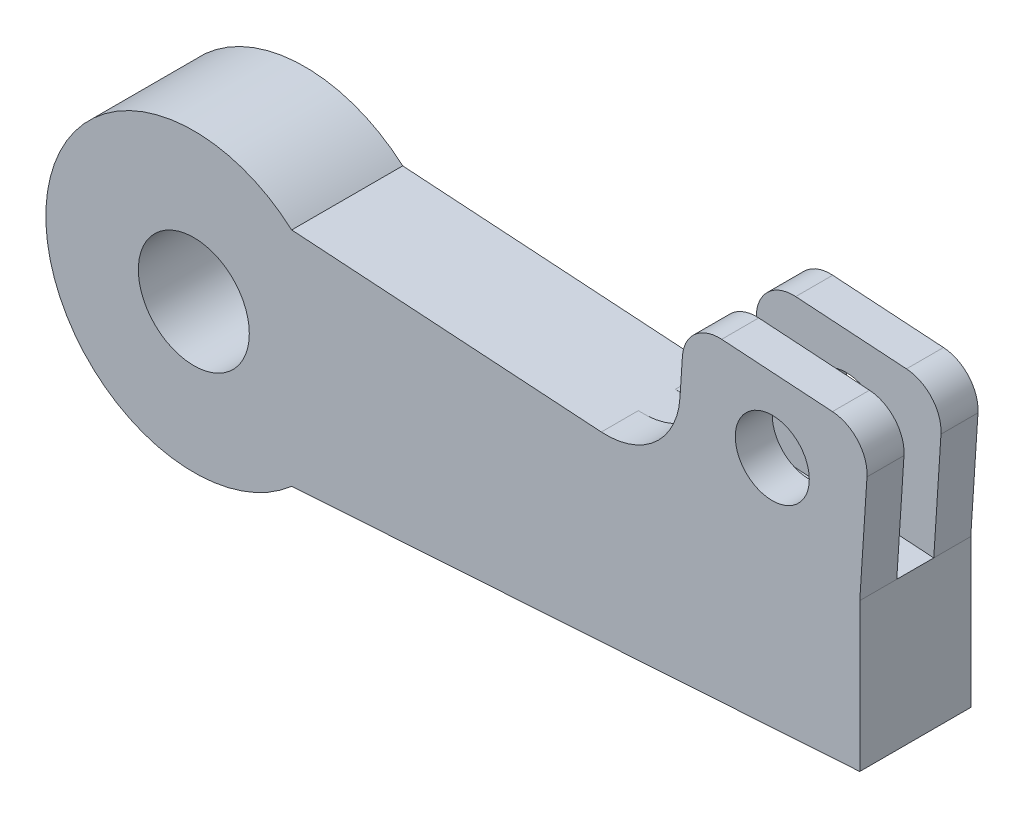
from build123d import *

# Parameters (mm, degrees)
SKETCH1_R           = 20
SKETCH1_R_2         = 7.5
BOSS_EXTRUDE1_DEPTH = 7.5
BOSS_EXTRUDE2_DEPTH = 7.5
SKETCH4_W           = 25
SKETCH4_H           = 5
BOSS_EXTRUDE3_DEPTH = 20
SKETCH5_R           = 5
CUT_EXTRUDE1_DEPTH  = 98.765588134
FILLET1_R           = 5
FILLET2_R           = 10


with BuildPart() as part:
    # Sketch1 → Boss-Extrude1 (new, symmetric)
    with BuildSketch(Plane.XY):
        Circle(SKETCH1_R)
        Circle(SKETCH1_R_2, mode=Mode.SUBTRACT)
    extrude(amount=BOSS_EXTRUDE1_DEPTH, both=True)

    # Sketch2 → Boss-Extrude2 (add, symmetric)
    with BuildSketch(Plane.XY):
        with BuildLine():
            Line((13.228756555, 15), (90, 10))
            Line((90, 10), (90, -10))
            Line((90, -10), (13.228756555, -15))
            ThreePointArc((13.228756555, -15), (20, 0), (13.228756555, 15))
        make_face()
    extrude(amount=BOSS_EXTRUDE2_DEPTH, both=True)

    # Sketch4 → Boss-Extrude3 (add)
    with BuildSketch(Plane(origin=(1.028677717, 15.794573482, 0), x_dir=(0.9978858591262095, -0.06499086209573425, 0), z_dir=(0.06499086209573425, 0.9978858591262095, 0))):
        with Locations((76.6598187, -5)):
            Rectangle(SKETCH4_W, SKETCH4_H)
        with Locations((76.6598187, 5)):
            Rectangle(SKETCH4_W, SKETCH4_H)
    extrude(amount=BOSS_EXTRUDE3_DEPTH)

    # Sketch5 → Cut-Extrude1 (cut, through all)
    with BuildSketch(Plane.XY.offset(7.5)):
        with Locations((78.176335382, 20.791244367)):
            Circle(SKETCH5_R)
    extrude(amount=-CUT_EXTRUDE1_DEPTH, mode=Mode.SUBTRACT)

    # Fillet1
    fillet1_edges = [part.edges().sort_by_distance(p)[0] for p in [
        (66.352670764, 31.582488735, 5),
        (91.299817242, 29.957717183, 5),
        (91.299817242, 29.957717183, -5),
        (66.352670764, 31.582488735, -5),
    ]]
    fillet(fillet1_edges, radius=FILLET1_R)

    # Fillet2
    fillet2_edges = [part.edges().sort_by_distance(p)[0] for p in [
        (65.052853522, 11.624771552, 5),
        (65.052853522, 11.624771552, -5),
    ]]
    fillet(fillet2_edges, radius=FILLET2_R)


solid = part.part
